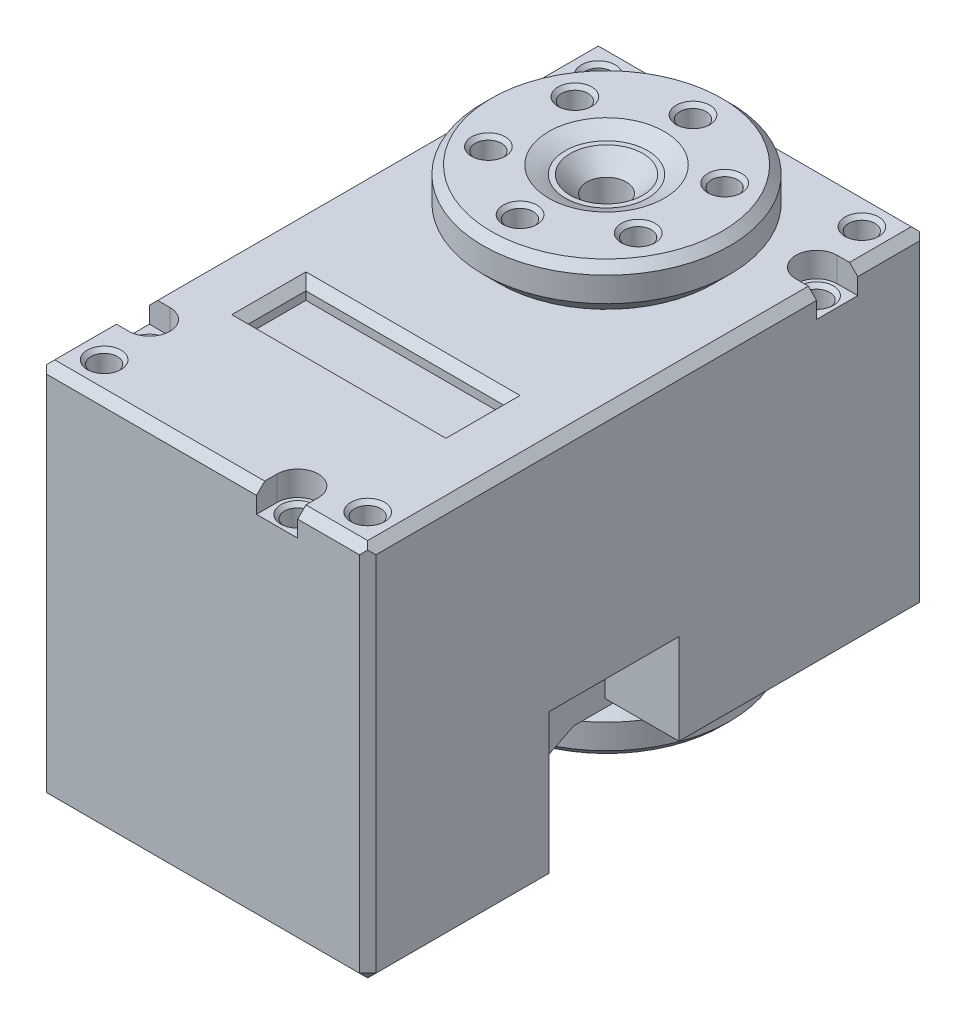
from build123d import *

# Parameters (mm, degrees)
SKETCH_1_W                   = 20
SKETCH_1_H                   = 34
EXTRUDE_1_DEPTH              = 20
SKETCH_5_R                   = 6.5
SKETCH_6_R                   = 7.5
SKETCH_7_R                   = 7.5
EXTRUDE_3_DEPTH              = 2
CHAMFER_2_SIZE               = 0.5
PATTERN_CIRCULAR_2_COUNT     = 6
HOLE_WIZARD_M2_3_D           = 1.6
HOLE_WIZARD_M2_3_DEPTH       = 6
HOLE_WIZARD_M2_3_CSINK_D     = 2.05
HOLE_WIZARD_M2_3_CSINK_ANGLE = 90
HOLE_WIZARD_M2_3_TIP         = 0.480688495
CUT_EXTRUDE_3_DEPTH          = 1.5
HOLE_WIZARD_M2_4_D           = 1.6
HOLE_WIZARD_M2_4_DEPTH       = 6
HOLE_WIZARD_M2_4_CSINK_D     = 2.05
HOLE_WIZARD_M2_4_CSINK_ANGLE = 90
HOLE_WIZARD_M2_4_TIP         = 0.480688495
SKETCH_19_W                  = 12
SKETCH_19_H                  = 3.5
CUT_EXTRUDE_4_DEPTH          = 1
CHAMFER_3_SIZE               = 0.5
CHAMFER_2_OF_MIRROR_4_SIZE   = 0.5
SKETCH_20_W                  = 4.5
SKETCH_20_H                  = 7.9
CUT_EXTRUDE_5_DEPTH          = 6
SKETCH_21_W                  = 1.9
SKETCH_21_H                  = 5.3
CUT_EXTRUDE_6_DEPTH          = 3.5
SKETCH_22_W                  = 20
SKETCH_22_H                  = 11
EXTRUDE_4_DEPTH              = 3
EXTRUDE_START                = -4.5
EXTRUDE_5_DEPTH              = 11
CUT_EXTRUDE_7_DEPTH          = 3
SKETCH_27_W                  = 6
SKETCH_27_H                  = 1.6
CUT_EXTRUDE_8_DEPTH          = 3
HOLE_WIZARD_M2_5_D           = 1.6
HOLE_WIZARD_M2_5_DEPTH       = 3
HOLE_WIZARD_M2_5_CSINK_D     = 2.05
HOLE_WIZARD_M2_5_CSINK_ANGLE = 90
HOLE_WIZARD_M2_5_TIP         = 0.480688495
CHAMFER_4_SIZE               = 0.5
CHAMFER_5_SIZE               = 0.5


with BuildPart() as part:
    # 草图1 → 凸台-拉伸1 (new body)
    with BuildSketch(Plane(origin=(0, 0, 0), x_dir=(1, 0, 0), z_dir=(0, 1, 0))):
        Rectangle(SKETCH_1_W, SKETCH_1_H)
    extrude(amount=EXTRUDE_1_DEPTH)

    # 草图5 → Loft 1 section 0
    with BuildSketch(Plane(origin=(0, 20, 0), x_dir=(1, 0, 0), z_dir=(0, 1, 0))):
        with Locations((0, 7.5)):
            Circle(SKETCH_5_R)
    # 草图6 → Loft 1 section 1
    with BuildSketch(Plane(origin=(0, 21, 0), x_dir=(1, 0, 0), z_dir=(0, 1, 0))):
        with Locations((0, 7.5)):
            Circle(SKETCH_6_R)
    loft_1 = loft()

    # 草图7 → 凸台-拉伸3 (add)
    with BuildSketch(Plane(origin=(0, 21, 0), x_dir=(1, 0, 0), z_dir=(0, 1, 0))):
        with Locations(Location((0, 7.5, 0), (0, 0, 270))):
            Circle(SKETCH_7_R)
    extrude_3 = extrude(amount=EXTRUDE_3_DEPTH)

    # 倒角2
    chamfer_2_edges = [part.edges().sort_by_distance(p)[0] for p in [
        (0, 23, -15),
    ]]
    chamfer(chamfer_2_edges, length=CHAMFER_2_SIZE)

    # 草图9 → M2 螺纹孔1 (revolve, cut)
    with BuildSketch(Plane(origin=(0, 23, -12.75), x_dir=(0, 0, 1), z_dir=(1, 0, 0))):
        Polygon((0, 0), (0, 3.480688495), (0.8, 3), (0.8, 0.225), (1.025, 0), align=None)
    hole_wizard_m2_1 = revolve(axis=Axis((0, 29.35, -12.75), (0, -1, 0)), mode=Mode.SUBTRACT)

    # 阵列(圆周)2: M2 螺纹孔1 ×6 about axis
    pattern_circular_2_axis = Axis((0, 0, -7.5), (0, 1, 0))
    for i in range(1, PATTERN_CIRCULAR_2_COUNT):
        add(hole_wizard_m2_1.rotate(pattern_circular_2_axis, i * 360 / PATTERN_CIRCULAR_2_COUNT), mode=Mode.SUBTRACT)

    # Loft 1 2: read off the stored shape, not the designer's step
    # Loft 1 2: loft between two sections, ruled curve by curve
    loft_1_2_from = [
        Edge.make_bspline([(-2.449323444, 22.5, -8.000814005), (-3.450951454, 22.5, -3.102167118), (1.447695433, 22.5, -2.100539107), (2.449323444, 22.5, -6.999185995), (3.450951454, 22.5, -11.897832882), (-1.447695433, 22.5, -12.899460893), (-2.449323444, 22.5, -8.000814005)], [0, 0, 0, 0, 0.5, 0.5, 0.5, 1, 1, 1, 1], 3, [1, 0.333333333, 0.333333333, 1, 0.333333333, 0.333333333, 1]),
    ]
    loft_1_2_to = [
        Edge.make_bspline([(-3.488483737, 23, -7.112649061), (-2.71378186, 23, -0.135681586), (4.263185615, 23, -0.910383464), (3.488483737, 23, -7.887350939), (2.71378186, 23, -14.864318414), (-4.263185615, 23, -14.089616536), (-3.488483737, 23, -7.112649061)], [0, 0, 0, 0, 0.5, 0.5, 0.5, 1, 1, 1, 1], 3, [1, 0.333333333, 0.333333333, 1, 0.333333333, 0.333333333, 1]),
    ]
    loft_1_2 = Solid(Shell([*[Face.make_surface_from_curves(loft_1_2_from[k], loft_1_2_to[k]) for k in range(1)], Face(Wire(loft_1_2_from)), Face(Wire(loft_1_2_to))]))
    add(loft_1_2, mode=Mode.SUBTRACT)

    # 草图13 → ST2.2 十字槽沉头自攻螺钉的锥形沉头孔1 (revolve, cut)
    with BuildSketch(Plane(origin=(0, 22.5, -7.5), x_dir=(0, 0, 1), z_dir=(1, 0, 0))):
        Polygon((0, 0), (0, 4.721032743), (1.2, 4), (1.2, 1), (2.2, 0), align=None)
    st2_2_1 = revolve(axis=Axis((0, 28.85, -7.5), (0, -1, 0)), mode=Mode.SUBTRACT)

    # M2 螺纹孔3
    with Locations(Plane(origin=(0, 20, 0), x_dir=(1, 0, 0), z_dir=(0, 1, 0))):
        with Locations((8, 15), (-8, 15), (-8, -15), (8, -15)):
            CounterSinkHole(HOLE_WIZARD_M2_3_D / 2, HOLE_WIZARD_M2_3_CSINK_D / 2, depth=HOLE_WIZARD_M2_3_DEPTH, counter_sink_angle=HOLE_WIZARD_M2_3_CSINK_ANGLE)
            with Locations((0, 0, -(HOLE_WIZARD_M2_3_DEPTH + HOLE_WIZARD_M2_3_TIP / 2))):  # 118° drill point
                Cone(0, HOLE_WIZARD_M2_3_D / 2, HOLE_WIZARD_M2_3_TIP, mode=Mode.SUBTRACT)

    # 草图16 → 切除-拉伸3 (cut)
    with BuildSketch(Plane(origin=(0, 20, 0), x_dir=(1, 0, 0), z_dir=(0, 1, 0))):
        with BuildLine():
            Line((-10, 12.75), (-8.75, 12.75))
            ThreePointArc((-8.75, 12.75), (-7.5, 11.5), (-8.75, 10.25))
            Line((-8.75, 10.25), (-10, 10.25))
            Line((-10, 10.25), (-10, 12.75))
        make_face()
        with BuildLine():
            Line((10, 10.25), (8.75, 10.25))
            ThreePointArc((8.75, 10.25), (7.5, 11.5), (8.75, 12.75))
            Line((8.75, 12.75), (10, 12.75))
            Line((10, 12.75), (10, 10.25))
        make_face()
        with BuildLine():
            Line((-10, -10.25), (-8.75, -10.25))
            ThreePointArc((-8.75, -10.25), (-7.5, -11.5), (-8.75, -12.75))
            Line((-8.75, -12.75), (-10, -12.75))
            Line((-10, -12.75), (-10, -10.25))
        make_face()
        with BuildLine():
            Line((3.248405474, -17), (3.248405474, -15.75))
            ThreePointArc((3.248405474, -15.75), (4.5, -14.498405474), (5.751594526, -15.75))
            Line((5.751594526, -15.75), (5.751594526, -17))
            Line((5.751594526, -17), (3.248405474, -17))
        make_face()
    extrude(amount=-CUT_EXTRUDE_3_DEPTH, mode=Mode.SUBTRACT)

    # M2 螺纹孔4
    with Locations(Plane(origin=(0, 18.5, 0), x_dir=(1, 0, 0), z_dir=(0, 1, 0))):
        with Locations((-8.75, -11.5), (-8.75, 11.5), (8.75, 11.5), (4.5, -15.75)):
            CounterSinkHole(HOLE_WIZARD_M2_4_D / 2, HOLE_WIZARD_M2_4_CSINK_D / 2, depth=HOLE_WIZARD_M2_4_DEPTH, counter_sink_angle=HOLE_WIZARD_M2_4_CSINK_ANGLE)
            with Locations((0, 0, -(HOLE_WIZARD_M2_4_DEPTH + HOLE_WIZARD_M2_4_TIP / 2))):  # 118° drill point
                Cone(0, HOLE_WIZARD_M2_4_D / 2, HOLE_WIZARD_M2_4_TIP, mode=Mode.SUBTRACT)

    # 草图19 → 切除-拉伸4 (cut)
    with BuildSketch(Plane(origin=(0, 20, 0), x_dir=(1, 0, 0), z_dir=(0, 1, 0))):
        with Locations((0, -6.5)):
            Rectangle(SKETCH_19_W, SKETCH_19_H)
    extrude(amount=-CUT_EXTRUDE_4_DEPTH, mode=Mode.SUBTRACT)

    # 倒角3
    chamfer_3_edges = [part.edges().sort_by_distance(p)[0] for p in [
        (-6, 20, 6.5),
        (0, 20, 8.25),
        (6, 20, 6.5),
        (0, 20, 4.75),
    ]]
    chamfer(chamfer_3_edges, length=CHAMFER_3_SIZE)

    # 镜向4: Loft 1, 凸台-拉伸3, M2 螺纹孔1 across plane
    add(loft_1.mirror(Plane.ZX.offset(10)))
    add(extrude_3.mirror(Plane.ZX.offset(10)))
    add(hole_wizard_m2_1.mirror(Plane.ZX.offset(10)), mode=Mode.SUBTRACT)

    # 镜向4 copy 1 sketch → 镜向4 copy 1 (revolve, cut)
    with BuildSketch(Plane(origin=(-4.54663337, -3, -10.125), x_dir=(0.8660254037844386, 0, 0.5000000000000001), z_dir=(0.5000000000000001, 0, -0.8660254037844386))):
        Polygon((0, 0), (0, -3.480688495), (0.8, -3), (0.8, -0.225), (1.025, 0), align=None)
    revolve(axis=Axis((-4.54663337, -9.35, -10.125), (0, -1, 0)), mode=Mode.SUBTRACT)

    # 镜向4 copy 2 sketch → 镜向4 copy 2 (revolve, cut)
    with BuildSketch(Plane(origin=(-4.54663337, -3, -4.875), x_dir=(0.8660254037844387, 0, -0.4999999999999998), z_dir=(-0.4999999999999998, 0, -0.8660254037844387))):
        Polygon((0, 0), (0, -3.480688495), (0.8, -3), (0.8, -0.225), (1.025, 0), align=None)
    revolve(axis=Axis((-4.54663337, -9.35, -4.875), (0, -1, 0)), mode=Mode.SUBTRACT)

    # 镜向4 copy 3 sketch → 镜向4 copy 3 (revolve, cut)
    with BuildSketch(Plane(origin=(0, -3, -2.25), x_dir=(0, 0, -1), z_dir=(-1, 0, 0))):
        Polygon((0, 0), (0, -3.480688495), (0.8, -3), (0.8, -0.225), (1.025, 0), align=None)
    revolve(axis=Axis((0, -9.35, -2.25), (0, -1, 0)), mode=Mode.SUBTRACT)

    # 镜向4 copy 4 sketch → 镜向4 copy 4 (revolve, cut)
    with BuildSketch(Plane(origin=(4.54663337, -3, -4.875), x_dir=(-0.8660254037844384, 0, -0.5000000000000004), z_dir=(-0.5000000000000004, 0, 0.8660254037844384))):
        Polygon((0, 0), (0, -3.480688495), (0.8, -3), (0.8, -0.225), (1.025, 0), align=None)
    revolve(axis=Axis((4.54663337, -9.35, -4.875), (0, -1, 0)), mode=Mode.SUBTRACT)

    # 镜向4 copy 5 sketch → 镜向4 copy 5 (revolve, cut)
    with BuildSketch(Plane(origin=(4.54663337, -3, -10.125), x_dir=(-0.8660254037844386, 0, 0.5000000000000001), z_dir=(0.5000000000000001, 0, 0.8660254037844386))):
        Polygon((0, 0), (0, -3.480688495), (0.8, -3), (0.8, -0.225), (1.025, 0), align=None)
    revolve(axis=Axis((4.54663337, -9.35, -10.125), (0, -1, 0)), mode=Mode.SUBTRACT)

    # 倒角2 of 镜向4
    chamfer_2_of_mirror_4_edges = [part.edges().sort_by_distance(p)[0] for p in [
        (0, -3, -15),
    ]]
    chamfer(chamfer_2_of_mirror_4_edges, length=CHAMFER_2_OF_MIRROR_4_SIZE)

    # 镜向5: Loft 1 2, ST2.2 十字槽沉头自攻螺钉的锥形沉头孔1 across plane
    add(loft_1_2.mirror(Plane.ZX.offset(10)), mode=Mode.SUBTRACT)
    add(st2_2_1.mirror(Plane.ZX.offset(10)), mode=Mode.SUBTRACT)

    # 草图20 → 切除-拉伸5 (cut)
    with BuildSketch(Plane.XZ):
        with Locations((-7.75, 2.05)):
            Rectangle(SKETCH_20_W, SKETCH_20_H)
    cut_extrude_5 = extrude(amount=-CUT_EXTRUDE_5_DEPTH, mode=Mode.SUBTRACT)

    # 草图21 → 切除-拉伸6 (cut)
    with BuildSketch(Plane.XZ.offset(-6)):
        with Locations((-7.65, 2.05)):
            Rectangle(SKETCH_21_W, SKETCH_21_H)
    cut_extrude_6 = extrude(amount=-CUT_EXTRUDE_6_DEPTH, mode=Mode.SUBTRACT)

    # 镜向6: 切除-拉伸5, 切除-拉伸6 across plane
    add(cut_extrude_5.mirror(Plane.ZY), mode=Mode.SUBTRACT)
    add(cut_extrude_6.mirror(Plane.ZY), mode=Mode.SUBTRACT)

    # 草图22 → 凸台-拉伸4 (add)
    with BuildSketch(Plane.XZ):
        with Locations((0, 11.5)):
            Rectangle(SKETCH_22_W, SKETCH_22_H)
    extrude(amount=EXTRUDE_4_DEPTH)

    # 草图25 → 凸台-拉伸5 (add)
    with BuildSketch(Plane(origin=(10, 0, 0), x_dir=(0, 0, -1), z_dir=(1, 0, 0)).offset(EXTRUDE_START)):
        Polygon((-6, -3), (0, 0), (-6, 0), align=None)
    extrude(amount=-EXTRUDE_5_DEPTH)

    # 草图26 → 切除-拉伸7 (cut)
    with BuildSketch(Plane.XZ):
        with BuildLine():
            Line((-5.5, 0), (5.5, 0))
            ThreePointArc((5.5, 0), (0, 1.800537619), (-5.5, 0))
        make_face()
    extrude(amount=CUT_EXTRUDE_7_DEPTH, mode=Mode.SUBTRACT)

    # 草图27 → 切除-拉伸8 (cut)
    with BuildSketch(Plane.XZ.offset(3)):
        with Locations((0, 4.2)):
            Rectangle(SKETCH_27_W, SKETCH_27_H)
    extrude(amount=-CUT_EXTRUDE_8_DEPTH, mode=Mode.SUBTRACT)

    # M2 螺纹孔5
    with Locations(Plane.XZ):
        with Locations((8, -15), (-8, -15)):
            CounterSinkHole(HOLE_WIZARD_M2_5_D / 2, HOLE_WIZARD_M2_5_CSINK_D / 2, depth=HOLE_WIZARD_M2_5_DEPTH, counter_sink_angle=HOLE_WIZARD_M2_5_CSINK_ANGLE)
            with Locations((0, 0, -(HOLE_WIZARD_M2_5_DEPTH + HOLE_WIZARD_M2_5_TIP / 2))):  # 118° drill point
                Cone(0, HOLE_WIZARD_M2_5_D / 2, HOLE_WIZARD_M2_5_TIP, mode=Mode.SUBTRACT)

    # M2 螺纹孔6: read off the stored shape, not the designer's step
    # M2 螺纹孔6 outline → M2 螺纹孔6 (revolve, cut)
    with BuildSketch(Plane(origin=(8, 0, 15), x_dir=(1, 0, 0), z_dir=(0, 0, 1))):
        Polygon((0.8, -2.775), (0.8, 2.2), (0, 2.680688495), (0, -3), (1.025, -3), align=None)
    revolve(axis=Axis((8, 0, 15), (0, 1, 0)), mode=Mode.SUBTRACT)

    # Hole Wizard M2 _6 2 outline → Hole Wizard M2 _6 2 (revolve, cut)
    with BuildSketch(Plane(origin=(-8, 0, 15), x_dir=(1, 0, 0), z_dir=(0, 0, 1))):
        Polygon((0.8, -2.775), (0.8, 2.2), (0, 2.680688495), (0, -3), (1.025, -3), align=None)
    revolve(axis=Axis((-8, 0, 15), (0, 1, 0)), mode=Mode.SUBTRACT)

    # 倒角4
    chamfer_4_edges = [part.edges().sort_by_distance(p)[0] for p in [
        (10, 20, -14.875),
        (7.875797263, 20, 17),
        (-10, 20, 0),
        (-10, 20, 14.875),
        (10, 20, 3.375),
        (0, 20, -17),
        (-10, 20, -14.875),
        (-3.375797263, 20, 17),
    ]]
    chamfer(chamfer_4_edges, length=CHAMFER_4_SIZE)

    # 倒角5
    chamfer_5_edges = [part.edges().sort_by_distance(p)[0] for p in [
        (-7.75, 0, -1.9),
        (10, 0, -9.45),
        (7.75, 0, -1.9),
        (-10, -3, 11.5),
        (-7.75, -3, 6),
        (10, -3, 11.5),
        (0, -3, 17),
        (7.75, -3, 6),
        (-10, 8.25, 17),
        (10, 8.25, 17),
        (-10, 9.75, -17),
        (10, 9.75, -17),
        (0, 0, -17),
        (-10, 0, -9.45),
    ]]
    chamfer(chamfer_5_edges, length=CHAMFER_5_SIZE)


solid = part.part
